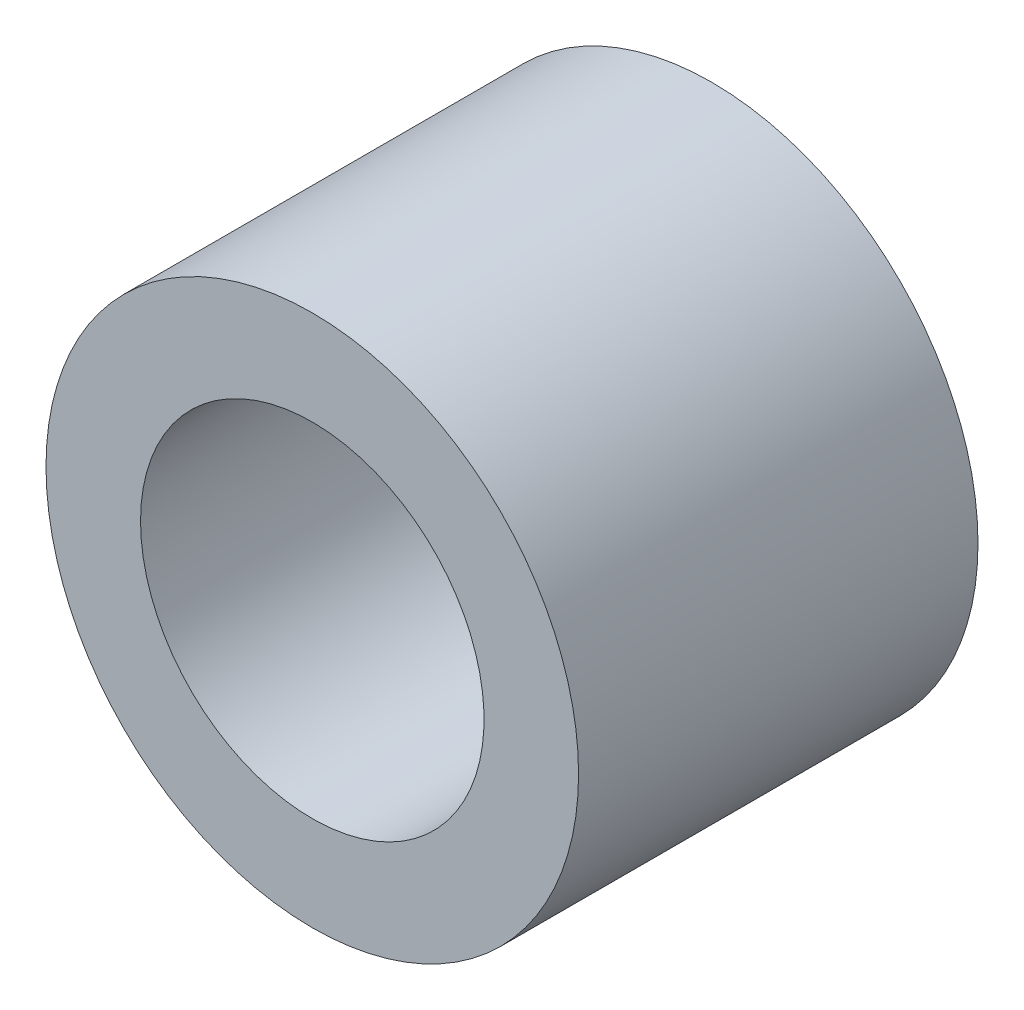
from build123d import *

# Parameters (mm, degrees)
SKETCH1_R      = 2.54
SKETCH1_R_2    = 1.6383
EXTRUDE1_DEPTH = 3.81


with BuildPart() as part:
    # Sketch1 → Extrude1 (new body)
    with BuildSketch(Plane.XY):
        Circle(SKETCH1_R)
        Circle(SKETCH1_R_2, mode=Mode.SUBTRACT)
    extrude(amount=EXTRUDE1_DEPTH)


solid = part.part
